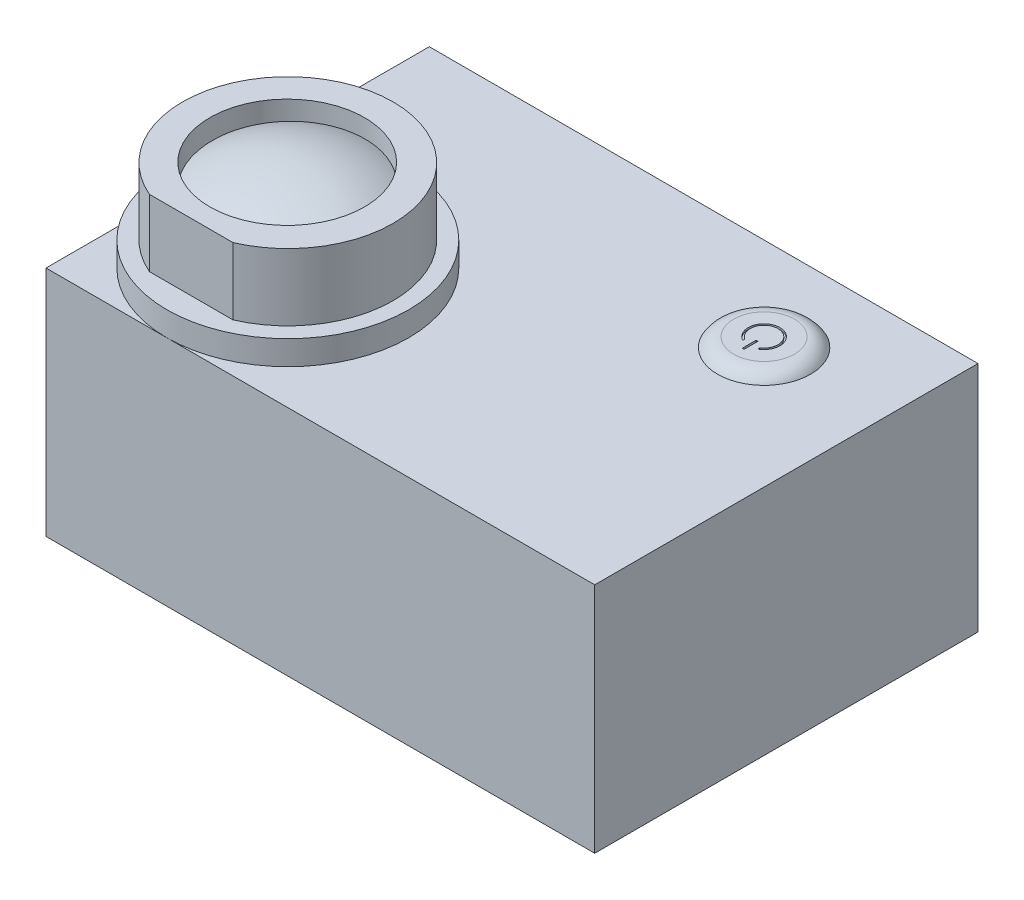
from build123d import *
from build123d.topology import SkipClean

# Parameters (mm, degrees)
CROQUIS1_W              = 59
CROQUIS1_H              = 41.21
SALIENTE_EXTRUIR1_DEPTH = 25
CROQUIS2_R              = 13
SALIENTE_EXTRUIR2_DEPTH = 9.81
CORTAR_EXTRUIR1_START   = -7.2
CROQUIS4_R              = 13
CROQUIS4_R_2            = 11.32
CORTAR_EXTRUIR1_DEPTH   = 7.2
CORTAR_EXTRUIR2_START   = -7.2
CORTAR_EXTRUIR2_DEPTH   = 7.2
CROQUIS7_R              = 8.32
CORTAR_EXTRUIR3_DEPTH   = 5
CROQUIS10_R             = 5
SALIENTE_EXTRUIR3_DEPTH = 1
REDONDEO1_R             = 2
CORTAR_EXTRUIR5_DEPTH   = 0.2
CROQUIS13_R             = 2.5
CORTAR_EXTRUIR6_DEPTH   = 5.2
ROSCA1_PITCH            = 0.8
CORTAR_EXTRUIR8_DEPTH   = 4
CROQUIS17_W             = 9.488888662
CROQUIS17_H             = 7.855040283
SALIENTE_EXTRUIR4_DEPTH = 10


with BuildPart() as part:
    # Croquis1 → Saliente-Extruir1 (new body)
    with BuildSketch(Plane(origin=(0, 0, 0), x_dir=(1, 0, 0), z_dir=(0, 1, 0))):
        Rectangle(CROQUIS1_W, CROQUIS1_H)
    extrude(amount=SALIENTE_EXTRUIR1_DEPTH)

    # Croquis2 → Saliente-Extruir2 (add)
    with BuildSketch(Plane(origin=(0, 25, 0), x_dir=(1, 0, 0), z_dir=(0, 1, 0))):
        with Locations(Location((-16.5, -7.605, 0), (0, 0, 270))):
            Circle(CROQUIS2_R)
    extrude(amount=SALIENTE_EXTRUIR2_DEPTH)

    # Croquis4 → Cortar-Extruir1 (cut)
    with BuildSketch(Plane(origin=(0, 34.81, 0), x_dir=(1, 0, 0), z_dir=(0, 1, 0)).offset(CORTAR_EXTRUIR1_START)):
        with Locations(Location((-16.5, -7.605, 0), (0, 0, 270))):
            Circle(CROQUIS4_R)
        with Locations(Location((-16.5, -7.605, 0), (0, 0, 270))):
            Circle(CROQUIS4_R_2, mode=Mode.SUBTRACT)
    extrude(amount=CORTAR_EXTRUIR1_DEPTH, mode=Mode.SUBTRACT)

    # Croquis6 → Cortar-Extruir2 (cut)
    with BuildSketch(Plane(origin=(0, 34.81, 0), x_dir=(1, 0, 0), z_dir=(0, 1, 0)).offset(CORTAR_EXTRUIR2_START)):
        with BuildLine():
            Line((-12.00663823, -17.995), (-20.99336177, -17.995))
            ThreePointArc((-20.99336177, -17.995), (-16.5, -18.925), (-12.00663823, -17.995))
        make_face()
    extrude(amount=CORTAR_EXTRUIR2_DEPTH, mode=Mode.SUBTRACT)

    # Croquis7 → Cortar-Extruir3 (cut)
    with BuildSketch(Plane(origin=(0, 34.81, 0), x_dir=(1, 0, 0), z_dir=(0, 1, 0))):
        with Locations(Location((-16.568588437, -7.600561682, 0), (0, 0, 270))):
            Circle(CROQUIS7_R)
    extrude(amount=-CORTAR_EXTRUIR3_DEPTH, mode=Mode.SUBTRACT)

    # Croquis9 → Revolución2 (revolve)
    with BuildSketch(Plane.ZY.offset(16.5)):
        with BuildLine():
            Line((15.920561682, 32.31), (7.14, 32.31))
            Line((7.14, 32.31), (7.14, 34.81))
            ThreePointArc((7.14, 34.81), (11.704763506, 34.17282232), (15.920561682, 32.31))
        make_face()
    revolve(axis=Axis((-16.5, 32.31, 7.14), (0, 1, 0)))

    # Croquis10 → Saliente-Extruir3 (add)
    with BuildSketch(Plane(origin=(0, 25, 0), x_dir=(1, 0, 0), z_dir=(0, 1, 0))):
        with Locations(Location((16.5, 10.605, 0), (0, 0, 270))):
            Circle(CROQUIS10_R)
    extrude(amount=SALIENTE_EXTRUIR3_DEPTH)

    # Redondeo1
    # the kernel refuses this fillet: 2 mm, written as the material it takes off along each edge
    with BuildSketch(Plane(origin=(16.5, 26, -10.605), x_dir=(0, 0, 1), z_dir=(-1, 0, 0))) as redondeo1_piece_1:
        with BuildLine():
            CenterArc((3.267949192, -2), REDONDEO1_R, 30, 60)
            Line((3.267949192, 0), (3.267949192, 0.04))
            Line((3.267949192, 0.04), (5, 0.04))
            Line((5, 0.04), (5.04, 0))
            ThreePointArc((5.04, 0), (5.04, -0.5), (5.034641016, -0.98))
            Line((5.034641016, -0.98), (5, -1))
        make_face()
    revolve(axis=Axis((16.5, 26, -10.605), (0, 1, 0)), mode=Mode.SUBTRACT)

    # Croquis12 → Cortar-Extruir5 (cut)
    with BuildSketch(Plane(origin=(0, 26, 0), x_dir=(1, 0, 0), z_dir=(0, 1, 0))):
        with BuildLine():
            Line((15.693774225, 9.194547086), (15.693774225, 9.312956107))
            ThreePointArc((15.693774225, 9.312956107), (15.687825385, 9.33660976), (15.671394411, 9.354634942))
            ThreePointArc((15.671394411, 9.354634942), (16.5, 12.105), (17.328605589, 9.354634942))
            ThreePointArc((17.328605589, 9.354634942), (17.312174615, 9.33660976), (17.306225775, 9.312956107))
            Line((17.306225775, 9.312956107), (17.306225775, 9.194547086))
            ThreePointArc((17.306225775, 9.194547086), (17.331703456, 9.150973517), (17.38217201, 9.151806089))
            ThreePointArc((17.38217201, 9.151806089), (16.5, 12.305), (15.61782799, 9.151806089))
            ThreePointArc((15.61782799, 9.151806089), (15.668296544, 9.150973517), (15.693774225, 9.194547086))
        make_face()
        with BuildLine():
            Line((16.55, 8.355), (16.45, 8.355))
            ThreePointArc((16.45, 8.355), (16.414644661, 8.369644661), (16.4, 8.405))
            Line((16.4, 8.405), (16.4, 9.805))
            ThreePointArc((16.4, 9.805), (16.414644661, 9.840355339), (16.45, 9.855))
            Line((16.45, 9.855), (16.55, 9.855))
            ThreePointArc((16.55, 9.855), (16.585355339, 9.840355339), (16.6, 9.805))
            Line((16.6, 9.805), (16.6, 8.405))
            ThreePointArc((16.6, 8.405), (16.585355339, 8.369644661), (16.55, 8.355))
        make_face()
    extrude(amount=-CORTAR_EXTRUIR5_DEPTH, mode=Mode.SUBTRACT)

    # Croquis13 → Cortar-Extruir6 (cut)
    with BuildSketch(Plane(origin=(0, 0, -20.605), x_dir=(-1, 0, 0), z_dir=(0, 0, -1))):
        with Locations((19, 13.3)):
            Circle(CROQUIS13_R)
    extrude(amount=-CORTAR_EXTRUIR6_DEPTH, mode=Mode.SUBTRACT)

    # Rosca1: the profile of Perfil de rosca1 profile screwed along a right-hand helix of 6.5 turns, 8 arcs to a turn; built about Z, then put on its axis
    with SkipClean():  # the faces are left unmerged after this step: merging them gives an invalid solid
        rosca1_z = Axis((0, 0, 0), (0, 0, 1))
        rosca1_corners = [(2.5003, 0, -0.000173205), (2.5003, 0, 0.700173203), (2.0669873, 0, 0.449999999), (2.0669873, 0, 0.249999999)]
        with BuildLine(mode=Mode.PRIVATE) as rosca1_profile:
            Line(rosca1_corners[0], rosca1_corners[1])
            Line(rosca1_corners[1], rosca1_corners[2])
            Line(rosca1_corners[2], rosca1_corners[3])
            Line(rosca1_corners[3], rosca1_corners[0])
        rosca1_cap = Face(rosca1_profile.wire())
        rosca1_turn_angles = [0, 22.5, 45, 67.5, 90, 112.5, 135, 157.5, 180, 202.5, 225, 247.5, 270, 292.5, 315, 337.5, 360]
        rosca1_turn_weights = [1, 0.9238795325112867, 1, 0.9238795325112867, 1, 0.9238795325112867, 1, 0.9238795325112867, 1, 0.9238795325112867, 1, 0.9238795325112867, 1, 0.9238795325112867, 1, 0.9238795325112867, 1]
        rosca1_turn_rails = [Edge.make_bspline([Vector(p[0], p[1], 0).rotate(rosca1_z, rosca1_turn_angles[k]) / rosca1_turn_weights[k] + Vector(0, 0, p[2] + ROSCA1_PITCH * rosca1_turn_angles[k] / 360) for k in range(17)], [0, 0, 0, 1, 1, 2, 2, 3, 3, 4, 4, 5, 5, 6, 6, 7, 7, 8, 8, 8], 2, rosca1_turn_weights) for p in rosca1_corners]
        rosca1_turn_sides = [Face.make_surface_from_curves(rosca1_turn_rails[p[0]], rosca1_turn_rails[p[1]]) for p in [(0, 1), (1, 2), (2, 3), (3, 0)]]
        rosca1_last_angles = [2160, 2182.5, 2205, 2227.5, 2250, 2272.5, 2295, 2317.5, 2340]
        rosca1_last_weights = [1, 0.9238795325112867, 1, 0.9238795325112867, 1, 0.9238795325112867, 1, 0.9238795325112867, 1]
        rosca1_last_rails = [Edge.make_bspline([Vector(p[0], p[1], 0).rotate(rosca1_z, rosca1_last_angles[k]) / rosca1_last_weights[k] + Vector(0, 0, p[2] + ROSCA1_PITCH * rosca1_last_angles[k] / 360) for k in range(9)], [0, 0, 0, 1, 1, 2, 2, 3, 3, 4, 4, 4], 2, rosca1_last_weights) for p in rosca1_corners]
        rosca1_last_sides = [Face.make_surface_from_curves(rosca1_last_rails[p[0]], rosca1_last_rails[p[1]]) for p in [(0, 1), (1, 2), (2, 3), (3, 0)]]
        rosca1 = Plane(origin=(-19, 13.3, -20.605), x_dir=(1, 0, 0), z_dir=(0, 0, 1)) * Solid(Shell([*[p.moved(Location((0, 0, ROSCA1_PITCH * i))) for i in range(6) for p in rosca1_turn_sides], *rosca1_last_sides, rosca1_cap, rosca1_cap.rotate(rosca1_z, 2340).moved(Location((0, 0, ROSCA1_PITCH * 2340 / 360)))]))
        add(rosca1)

    # Croquis16 → Cortar-Extruir8 (cut)
    with SkipClean():  # the faces are left unmerged after this step: merging them gives an invalid solid
        with BuildSketch(Plane.ZY.offset(29.5)):
            with BuildLine():
                Line((-5.945, 19.16), (-6.951704527, 20.240791007))
                ThreePointArc((-6.951704527, 20.240791007), (-7.118070383, 20.358473284), (-7.317575391, 20.4))
                Line((-7.317575391, 20.4), (-12.532424609, 20.4))
                ThreePointArc((-12.532424609, 20.4), (-12.731929617, 20.358473284), (-12.898295473, 20.240791007))
                Line((-12.898295473, 20.240791007), (-13.905, 19.16))
                Line((-13.905, 19.16), (-13.905, 16.9))
                ThreePointArc((-13.905, 16.9), (-13.758553391, 16.546446609), (-13.405, 16.4))
                Line((-13.405, 16.4), (-6.445, 16.4))
                ThreePointArc((-6.445, 16.4), (-6.091446609, 16.546446609), (-5.945, 16.9))
                Line((-5.945, 16.9), (-5.945, 19.16))
            make_face()
            with BuildLine():
                Line((1.93, 19.16), (1.330694375, 20.15750198))
                ThreePointArc((1.330694375, 20.15750198), (1.148320916, 20.335172948), (0.902100476, 20.4))
                Line((0.902100476, 20.4), (-2.392100476, 20.4))
                ThreePointArc((-2.392100476, 20.4), (-2.638320916, 20.335172948), (-2.820694375, 20.15750198))
                Line((-2.820694375, 20.15750198), (-3.42, 19.16))
                Line((-3.42, 19.16), (-3.42, 18.16))
                ThreePointArc((-3.42, 18.16), (-3.273553391, 17.806446609), (-2.92, 17.66))
                Line((-2.92, 17.66), (1.43, 17.66))
                ThreePointArc((1.43, 17.66), (1.783553391, 17.806446609), (1.93, 18.16))
                Line((1.93, 18.16), (1.93, 19.16))
            make_face()
            with BuildLine():
                ThreePointArc((-1.736855309, 8.079208993), (-1.903221166, 7.961526716), (-2.102726174, 7.92))
                Line((-2.102726174, 7.92), (-7.317575391, 7.92))
                ThreePointArc((-7.317575391, 7.92), (-7.517080399, 7.961526716), (-7.683446256, 8.079208993))
                Line((-7.683446256, 8.079208993), (-8.690150783, 9.16))
                Line((-8.690150783, 9.16), (-8.690150783, 11.42))
                ThreePointArc((-8.690150783, 11.42), (-8.543704173, 11.773553391), (-8.190150783, 11.92))
                Line((-8.190150783, 11.92), (-1.230150783, 11.92))
                ThreePointArc((-1.230150783, 11.92), (-0.876597392, 11.773553391), (-0.730150783, 11.42))
                Line((-0.730150783, 11.42), (-0.730150783, 9.16))
                Line((-0.730150783, 9.16), (-1.736855309, 8.079208993))
            make_face()
        extrude(amount=-CORTAR_EXTRUIR8_DEPTH, mode=Mode.SUBTRACT)

    # Croquis17 → Saliente-Extruir4 (add)
    with BuildSketch(Plane(origin=(0, 0, -20.605), x_dir=(-1, 0, 0), z_dir=(0, 0, -1))):
        with Locations((19.260558774, 13.137356389)):
            Rectangle(CROQUIS17_W, CROQUIS17_H)
    extrude(amount=-SALIENTE_EXTRUIR4_DEPTH)


solid = part.part
